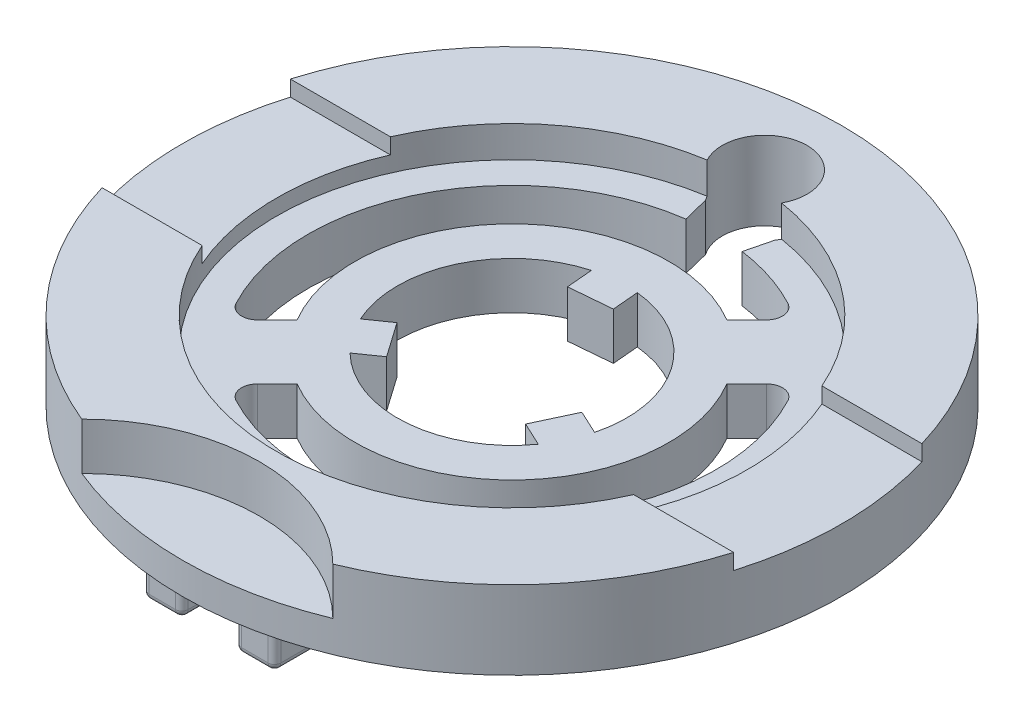
from build123d import *

# Parameters (mm, degrees)
SKETCH2_R           = 10.5
SKETCH2_R_2         = 7.5
BOSS_EXTRUDE1_DEPTH = 2.5
SKETCH2_3_R         = 7.5
SKETCH2_3_R_2       = 6.5
BOSS_EXTRUDE2_DEPTH = 1.5
SKETCH3_W           = 30
SKETCH3_H           = 6
CUT_EXTRUDE1_DEPTH  = 0.5
CUT_EXTRUDE2_START  = -1.5
CUT_EXTRUDE2_DEPTH  = 1.5
SKETCH5_R           = 5
SKETCH5_R_2         = 3.65
BOSS_EXTRUDE3_DEPTH = 1.5
FILLET1_R           = 0.5
CUT_EXTRUDE3_START  = -2.5
CUT_EXTRUDE3_DEPTH  = 2.5
BOSS_EXTRUDE4_DEPTH = 1.5
FILLET2_R           = 0.2


# Read off the part's stored shape, not the designer's step: Cut-Extrude3
with BuildPart() as part:
    # Sketch2 → Boss-Extrude1 (new body)
    with BuildSketch(Plane(origin=(0, 0, 0), x_dir=(1, 0, 0), z_dir=(0, 1, 0))):
        with Locations(Location((0, 0, 0), (0, 0, 270))):
            Circle(SKETCH2_R)
        with Locations(Location((0, 0, 0), (0, 0, 270))):
            Circle(SKETCH2_R_2, mode=Mode.SUBTRACT)
    extrude(amount=BOSS_EXTRUDE1_DEPTH)

    # Sketch2<3> → Boss-Extrude2 (add)
    with BuildSketch(Plane(origin=(0, 0, 0), x_dir=(1, 0, 0), z_dir=(0, 1, 0))):
        with Locations(Location((0, 0, 0), (0, 0, 270))):
            Circle(SKETCH2_3_R)
        with Locations(Location((0, 0, 0), (0, 0, 270))):
            Circle(SKETCH2_3_R_2, mode=Mode.SUBTRACT)
    extrude(amount=BOSS_EXTRUDE2_DEPTH)

    # Sketch3 → Cut-Extrude1 (cut)
    with BuildSketch(Plane(origin=(0, 2.5, 0), x_dir=(1, 0, 0), z_dir=(0, 1, 0))):
        Rectangle(SKETCH3_W, SKETCH3_H)
    extrude(amount=-CUT_EXTRUDE1_DEPTH, mode=Mode.SUBTRACT)

    # Sketch4 → Cut-Extrude2 (cut)
    with BuildSketch(Plane(origin=(0, 2.5, 0), x_dir=(1, 0, 0), z_dir=(0, 1, 0)).offset(CUT_EXTRUDE2_START)):
        with BuildLine():
            Line((-4, -9.708243919), (4, -9.708243919))
            ThreePointArc((4, -9.708243919), (0, -8.05), (-4, -9.708243919))
        make_face()
        with BuildLine():
            ThreePointArc((-4, -9.708243919), (0, -10.5), (4, -9.708243919))
            Line((4, -9.708243919), (-4, -9.708243919))
        make_face()
    extrude(amount=CUT_EXTRUDE2_DEPTH, mode=Mode.SUBTRACT)

    # Sketch5 → Boss-Extrude3 (add)
    # profile 1 of 6: a face of its own
    with BuildSketch(Plane(origin=(0, 0, 0), x_dir=(1, 0, 0), z_dir=(0, 1, 0))):
        Circle(SKETCH5_R)
        Circle(SKETCH5_R_2, mode=Mode.SUBTRACT)
    # profile 2 of 6: a face of its own
    with BuildSketch(Plane(origin=(0, 0, 0), x_dir=(1, 0, 0), z_dir=(0, 1, 0))):
        with BuildLine():
            Line((-4.307149461, -2.539382508), (-5.394288115, -3.626521162))
            ThreePointArc((-5.394288115, -3.626521162), (-4.596194078, -4.596194078), (-3.626521162, -5.394288115))
            Line((-3.626521162, -5.394288115), (-2.539382508, -4.307149461))
            ThreePointArc((-2.539382508, -4.307149461), (-3.535533906, -3.535533906), (-4.307149461, -2.539382508))
        make_face()
    # profile 3 of 6: a face of its own
    with BuildSketch(Plane(origin=(0, 0, 0), x_dir=(1, 0, 0), z_dir=(0, 1, 0))):
        with BuildLine():
            ThreePointArc((2.965697363, -2.127707487), (3.308023423, -1.542556655), (3.536232016, -0.904191975))
            Line((3.536232016, -0.904191975), (2.777613741, -0.550442464))
            Line((2.777613741, -0.550442464), (2.207079088, -1.773957976))
            Line((2.207079088, -1.773957976), (2.965697363, -2.127707487))
        make_face()
    # profile 4 of 6: a face of its own
    with BuildSketch(Plane(origin=(0, 0, 0), x_dir=(1, 0, 0), z_dir=(0, 1, 0))):
        with BuildLine():
            Line((-2.639832216, -1.02440757), (-3.325497417, -1.504515512))
            ThreePointArc((-3.325497417, -1.504515512), (-2.989904962, -2.093553993), (-2.551169228, -2.610370772))
            Line((-2.551169228, -2.610370772), (-1.865504027, -2.13026283))
            Line((-1.865504027, -2.13026283), (-2.639832216, -1.02440757))
        make_face()
    # profile 5 of 6: a face of its own
    with BuildSketch(Plane(origin=(0, 0, 0), x_dir=(1, 0, 0), z_dir=(0, 1, 0))):
        with BuildLine():
            Line((0.432753129, 2.798365546), (0.359800054, 3.632223))
            ThreePointArc((0.359800054, 3.632223), (-0.318118461, 3.636110648), (-0.985062788, 3.514562747))
            Line((-0.985062788, 3.514562747), (-0.912109714, 2.680705293))
            Line((-0.912109714, 2.680705293), (0.432753129, 2.798365546))
        make_face()
    # profile 6 of 6: a face of its own
    with BuildSketch(Plane(origin=(0, 0, 0), x_dir=(1, 0, 0), z_dir=(0, 1, 0))):
        with BuildLine():
            ThreePointArc((5.394288115, 3.626521162), (4.596194078, 4.596194078), (3.626521162, 5.394288115))
            Line((3.626521162, 5.394288115), (2.539382508, 4.307149461))
            ThreePointArc((2.539382508, 4.307149461), (3.535533906, 3.535533906), (4.307149461, 2.539382508))
            Line((4.307149461, 2.539382508), (5.394288115, 3.626521162))
        make_face()
    extrude(amount=BOSS_EXTRUDE3_DEPTH)

    # Fillet1
    fillet1_edges = [part.edges().sort_by_distance(p)[0] for p in [
        (5.394288115, 0.75, -3.626521162),
        (3.626521162, 0.75, -5.394288115),
        (-5.394288115, 0.75, 3.626521162),
        (-3.626521162, 0.75, 5.394288115),
    ]]
    fillet(fillet1_edges, radius=FILLET1_R)

    # Cut-Extrude3 outline → Cut-Extrude3 (cut)
    with BuildSketch(Plane(origin=(0, 2.5, 0), x_dir=(1, 0, 0), z_dir=(0, 1, 0)).offset(CUT_EXTRUDE3_START)):
        with BuildLine():
            Line((-1.104124308, 7.273205617), (-0.895875692, 6.437966041))
            ThreePointArc((-0.895875692, 6.437966041), (0, 6.5), (0.895875692, 6.437966041))
            Line((0.895875692, 6.437966041), (1.104124308, 7.273205617))
            ThreePointArc((1.104124308, 7.273205617), (0, 9.4), (-1.104124308, 7.273205617))
        make_face()
    extrude(amount=CUT_EXTRUDE3_DEPTH, mode=Mode.SUBTRACT)

    # Sketch7 → Boss-Extrude4 (add)
    with BuildSketch(Plane.XZ):
        with BuildLine():
            Line((1.05, 6.667886814), (1.9, 6.667886814))
            ThreePointArc((1.9, 6.667886814), (2.041421356, 6.726465457), (2.1, 6.867886814))
            Line((2.1, 6.867886814), (2.1, 9.467886814))
            ThreePointArc((2.1, 9.467886814), (2.041421356, 9.60930817), (1.9, 9.667886814))
            Line((1.9, 9.667886814), (1.05, 9.667886814))
            ThreePointArc((1.05, 9.667886814), (0.908578644, 9.60930817), (0.85, 9.467886814))
            Line((0.85, 9.467886814), (0.85, 6.867886814))
            ThreePointArc((0.85, 6.867886814), (0.908578644, 6.726465457), (1.05, 6.667886814))
        make_face()
        with BuildLine():
            Line((-2.1, 6.867886814), (-2.1, 9.467886814))
            ThreePointArc((-2.1, 9.467886814), (-2.041421356, 9.60930817), (-1.9, 9.667886814))
            Line((-1.9, 9.667886814), (-1.05, 9.667886814))
            ThreePointArc((-1.05, 9.667886814), (-0.908578644, 9.60930817), (-0.85, 9.467886814))
            Line((-0.85, 9.467886814), (-0.85, 6.867886814))
            ThreePointArc((-0.85, 6.867886814), (-0.908578644, 6.726465457), (-1.05, 6.667886814))
            Line((-1.05, 6.667886814), (-1.9, 6.667886814))
            ThreePointArc((-1.9, 6.667886814), (-2.041421356, 6.726465457), (-2.1, 6.867886814))
        make_face()
    extrude(amount=BOSS_EXTRUDE4_DEPTH)

    # Fillet2
    fillet2_edges = [part.edges().sort_by_distance(p)[0] for p in [
        (2.041421356, -1.5, 6.726465457),
        (2.1, -1.5, 8.167886814),
        (2.041421356, -1.5, 9.60930817),
        (1.475, -1.5, 9.667886814),
        (0.908578644, -1.5, 9.60930817),
        (0.85, -1.5, 8.167886814),
        (0.908578644, -1.5, 6.726465457),
        (1.475, -1.5, 6.667886814),
        (-0.908578644, -1.5, 9.60930817),
        (-1.475, -1.5, 9.667886814),
        (-2.041421356, -1.5, 9.60930817),
        (-2.1, -1.5, 8.167886814),
        (-2.041421356, -1.5, 6.726465457),
        (-1.475, -1.5, 6.667886814),
        (-0.908578644, -1.5, 6.726465457),
        (-0.85, -1.5, 8.167886814),
    ]]
    fillet(fillet2_edges, radius=FILLET2_R)


solid = part.part
